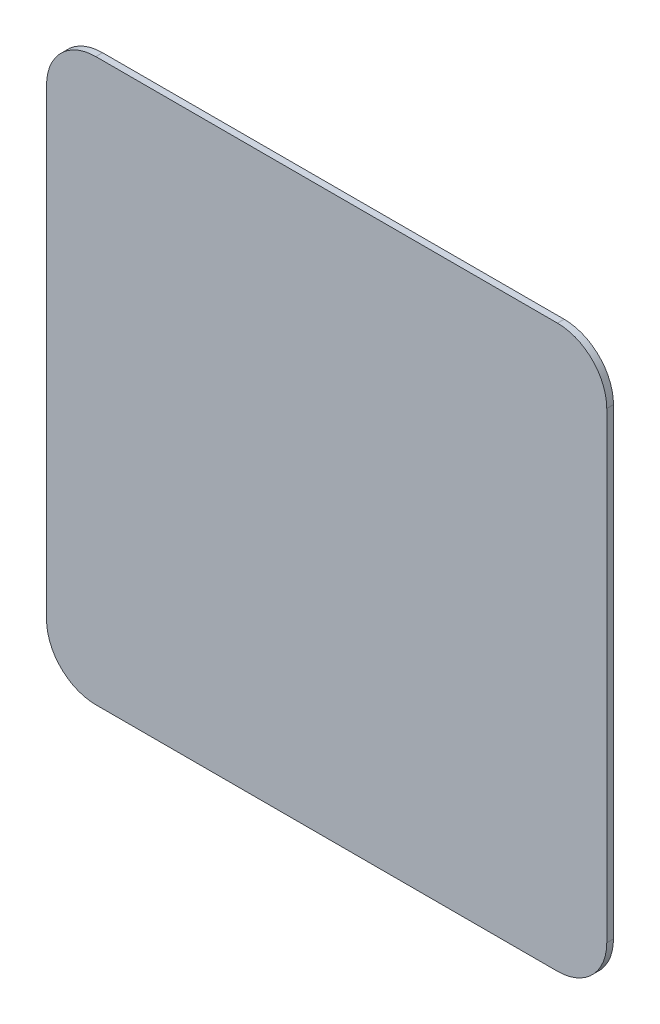
from build123d import *

# Parameters (mm, degrees)
SKETCH1_W           = 500
SKETCH1_H           = 501
BOSS_EXTRUDE1_DEPTH = 6
FILLET1_R           = 44


with BuildPart() as part:
    # Sketch1 → Boss-Extrude1 (new body)
    with BuildSketch(Plane.XY):
        with Locations((250, 250.5)):
            Rectangle(SKETCH1_W, SKETCH1_H)
    extrude(amount=BOSS_EXTRUDE1_DEPTH)

    # Fillet1
    fillet1_edges = [part.edges().sort_by_distance(p)[0] for p in [
        (0, 0, 3),
        (0, 501, 3),
        (500, 0, 3),
        (500, 501, 3),
    ]]
    fillet(fillet1_edges, radius=FILLET1_R)


solid = part.part
